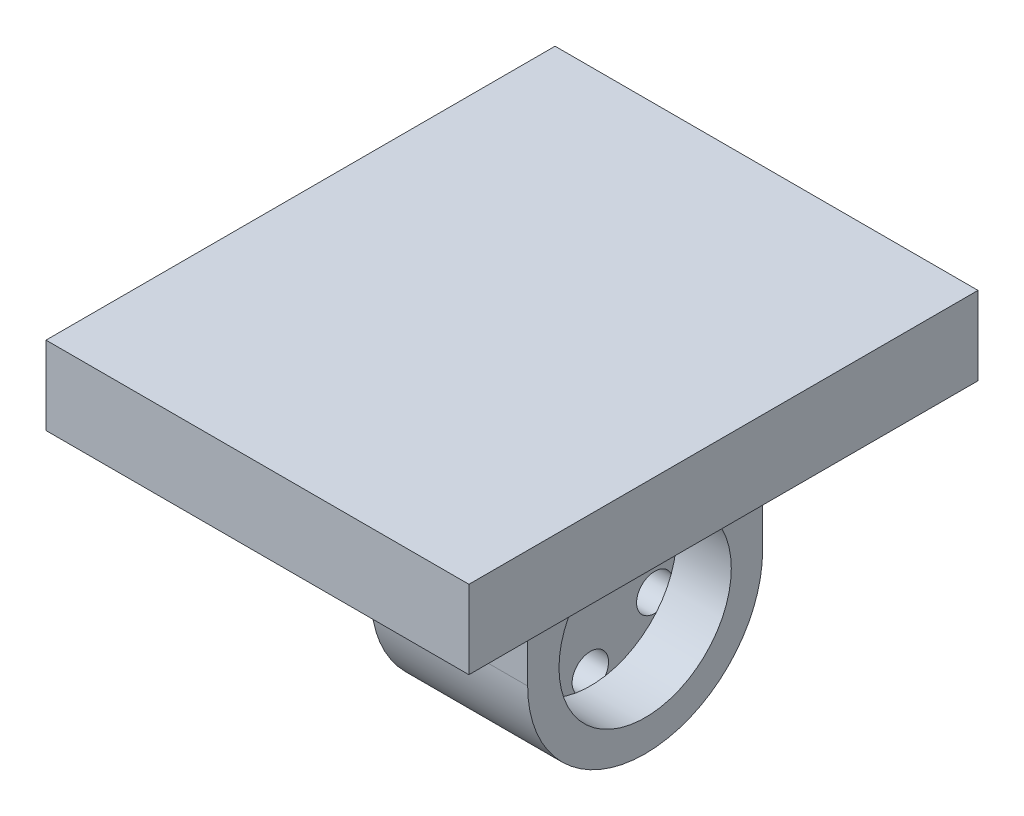
from build123d import *

# Parameters (mm, degrees)
SKETCH1_W           = 54
SKETCH1_H           = 65
BOSS_EXTRUDE1_DEPTH = 10
SKETCH2_W           = 20
SKETCH2_H           = 30
BOSS_EXTRUDE2_DEPTH = 30
FILLET1_R           = 15
SKETCH3_R           = 11
CUT_EXTRUDE1_DEPTH  = 7
SKETCH4_R           = 6
CUT_EXTRUDE2_DEPTH  = 5
SKETCH5_R           = 1.5875
CUT_EXTRUDE3_DEPTH  = 7
SKETCH6_R           = 2.3241
CUT_EXTRUDE4_DEPTH  = 6


with BuildPart() as part:
    # Sketch1 → Boss-Extrude1 (new body)
    with BuildSketch(Plane(origin=(0, 0, 0), x_dir=(1, 0, 0), z_dir=(0, 1, 0))):
        Rectangle(SKETCH1_W, SKETCH1_H)
    extrude(amount=BOSS_EXTRUDE1_DEPTH)

    # Sketch2 → Boss-Extrude2 (add)
    with BuildSketch(Plane.XZ):
        with Locations((7, 0)):
            Rectangle(SKETCH2_W, SKETCH2_H)
    extrude(amount=BOSS_EXTRUDE2_DEPTH)

    # Fillet1
    fillet1_edges = [part.edges().sort_by_distance(p)[0] for p in [
        (7, -30, -15),
        (7, -30, 15),
    ]]
    fillet(fillet1_edges, radius=FILLET1_R - 0.0001)  # a hair under: the kernel refuses the full size

    # Sketch3 → Cut-Extrude1 (cut)
    with BuildSketch(Plane(origin=(17, 0, 0), x_dir=(0, 0, -1), z_dir=(1, 0, 0))):
        with Locations((0, -15)):
            Circle(SKETCH3_R)
    extrude(amount=-CUT_EXTRUDE1_DEPTH, mode=Mode.SUBTRACT)

    # Sketch4 → Cut-Extrude2 (cut)
    with BuildSketch(Plane.ZY.offset(3)):
        with Locations((0, -15)):
            Circle(SKETCH4_R)
    extrude(amount=-CUT_EXTRUDE2_DEPTH, mode=Mode.SUBTRACT)

    # Sketch5 → Cut-Extrude3 (cut)
    with BuildSketch(Plane.ZY.offset(3)):
        with Locations((0, -5.5)):
            Circle(SKETCH5_R)
        with Locations((8.227241336, -10.25)):
            Circle(SKETCH5_R)
        with Locations((8.227241336, -19.75)):
            Circle(SKETCH5_R)
        with Locations((0, -24.5)):
            Circle(SKETCH5_R)
        with Locations((-8.227241336, -19.75)):
            Circle(SKETCH5_R)
        with Locations((-8.227241336, -10.25)):
            Circle(SKETCH5_R)
    extrude(amount=-CUT_EXTRUDE3_DEPTH, mode=Mode.SUBTRACT)

    # Sketch6 → Cut-Extrude4 (cut)
    with BuildSketch(Plane(origin=(10, 0, 0), x_dir=(0, 0, -1), z_dir=(1, 0, 0))):
        with Locations((0, -5.5)):
            Circle(SKETCH6_R)
        with Locations((8.227241336, -10.25)):
            Circle(SKETCH6_R)
        with Locations((8.227241336, -19.75)):
            Circle(SKETCH6_R)
        with Locations((0, -24.5)):
            Circle(SKETCH6_R)
        with Locations((-8.227241336, -19.75)):
            Circle(SKETCH6_R)
        with Locations((-8.227241336, -10.25)):
            Circle(SKETCH6_R)
    extrude(amount=-CUT_EXTRUDE4_DEPTH, mode=Mode.SUBTRACT)


solid = part.part
